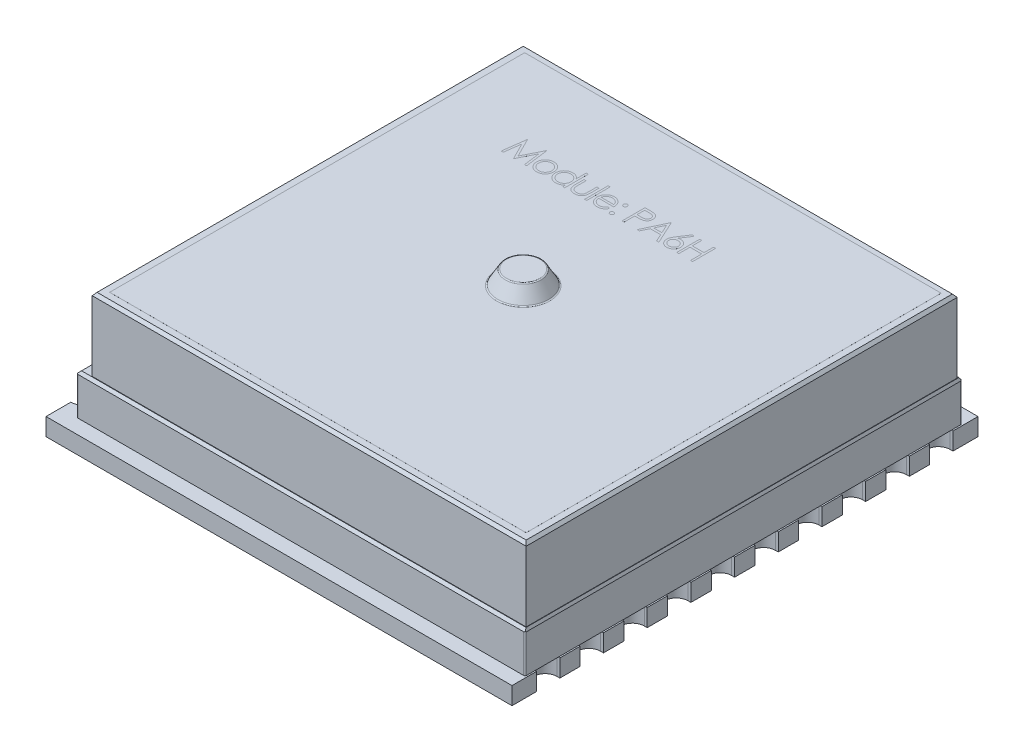
from build123d import *
from OCP.BRepFilletAPI import BRepFilletAPI_MakeChamfer

# Parameters (mm, degrees)
ESBO_O1_W                = 16
ESBO_O1_H                = 16
BASEINICIO_DEPTH         = 0.6
ESBO_O2_W                = 15.4
ESBO_O2_H                = 15
BASEMEIO_DEPTH           = 1.4
ESBO_O5_W                = 14.9
ESBO_O5_H                = 14.8
BASEFIM_DEPTH            = 2.5
ESBO_O9_R                = 0.6
CHAPEU_DEPTH             = 0.5
INCLINA_OCHAPEU_ANGLE    = 30
ESBO_O10_W               = 1
ESBO_O10_H               = 1
PADS_DEPTH               = 0.0001
ESBO_O11_W               = 0.4
ESBO_O11_H               = 0.6001
CORTE_REVOLU_O1_ANGLE    = 180
ESBO_O11_8_W             = 0.4
ESBO_O11_8_H             = 0.6001
CORTE_REVOLU_O2_ANGLE    = 180
ESBO_O11_9_W             = 0.4
ESBO_O11_9_H             = 0.6001
CORTE_REVOLU_O3_ANGLE    = 180
ESBO_O11_11_W            = 0.4
ESBO_O11_11_H            = 0.6001
CORTE_REVOLU_O4_ANGLE    = 180
ESBO_O11_12_W            = 0.4
ESBO_O11_12_H            = 0.6001
CORTE_REVOLU_O5_ANGLE    = 180
ESBO_O11_15_W            = 0.4
ESBO_O11_15_H            = 0.6001
ESBO_O11_16_W            = 0.4
ESBO_O11_16_H            = 0.6001
ESBO_O11_17_W            = 0.4
ESBO_O11_17_H            = 0.6001
ESBO_O11_19_W            = 0.4
ESBO_O11_19_H            = 0.6001
ESBO_O11_20_W            = 0.4
ESBO_O11_20_H            = 0.6001
ESBO_O15_W               = 0.8
ESBO_O15_H               = 0.6001
CORTE_EXTRUS_O3_DEPTH    = 0.5
FILETE5_R                = 0.4
FILETE6_R                = 0.4
FILETE7_R                = 0.4
FILETE8_R                = 0.4
FILETE9_R                = 0.4
FILETE10_R               = 0.4
FILETE11_R               = 0.4
FILETE12_R               = 0.4
FILETE13_R               = 0.4
FILETE14_R               = 0.4
CHANFRO2_SIZE            = 0.1
CHANFRO3_SIZE            = 0.1
CHANFRO3_SIZE2           = 0.070020754
CHANFRO4_SIZE            = 0.1
CHANFRO4_SIZE2           = 0.036397023
CHANFRO5_SIZE            = 0.1
CHANFRO5_SIZE2           = 0.083909963
ESBO_O16_W               = 14.299969375
ESBO_O16_H               = 14.24827011
RESSALTO_EXTRUS_O7_DEPTH = 0.001
FILETE15_R               = 0.05
ESBO_O17_W               = 0.07053833
ESBO_O17_H               = 0.806152344
RESSALTO_EXTRUS_O8_DEPTH = 0.0001
FILETE19_R               = 0.05
FILETE20_R               = 0.05


with BuildPart() as part:
    # Esboço1 → BaseInicio (new body)
    with BuildSketch(Plane(origin=(0, 0, 0), x_dir=(1, 0, 0), z_dir=(0, 1, 0))):
        with Locations((8, -8)):
            Rectangle(ESBO_O1_W, ESBO_O1_H)
    extrude(amount=BASEINICIO_DEPTH)

    # Esboço2 → BaseMeio (add)
    with BuildSketch(Plane(origin=(0, 0.6, 0), x_dir=(1, 0, 0), z_dir=(0, 1, 0))):
        with Locations((8.25, -8)):
            Rectangle(ESBO_O2_W, ESBO_O2_H)
    extrude(amount=BASEMEIO_DEPTH)

    # Esboço5 → BaseFim (add)
    with BuildSketch(Plane(origin=(0, 2, 0), x_dir=(1, 0, 0), z_dir=(0, 1, 0))):
        with Locations((8.45, -8.014489778)):
            Rectangle(ESBO_O5_W, ESBO_O5_H)
    extrude(amount=BASEFIM_DEPTH)

    # Esboço9 → Chapeu (add)
    with BuildSketch(Plane(origin=(0, 4.5, 0), x_dir=(1, 0, 0), z_dir=(0, 1, 0))):
        with Locations(Location((8.2, -7.814489778, 0), (0, 0, 270))):
            Circle(ESBO_O9_R)
    extrude(amount=CHAPEU_DEPTH)

    # InclinaçãoChapeu
    inclina_ochapeu_faces = [part.faces().sort_by_distance(p)[0] for p in [
        (8.2, 4.75, 7.214489778),
    ]]
    draft(inclina_ochapeu_faces, Plane(origin=(8.2, 5, 7.814489778), x_dir=(0, 0, 1), z_dir=(0, 1, 0)), INCLINA_OCHAPEU_ANGLE)

    # Esboço10 → Pads (add)
    with BuildSketch(Plane.XZ):
        with Locations((0.5, 1.25)):
            Rectangle(ESBO_O10_W, ESBO_O10_H)
        with Locations((0.5, 2.75)):
            Rectangle(ESBO_O10_W, ESBO_O10_H)
        with Locations((0.5, 4.25)):
            Rectangle(ESBO_O10_W, ESBO_O10_H)
        with Locations((0.5, 5.75)):
            Rectangle(ESBO_O10_W, ESBO_O10_H)
        with Locations((0.5, 7.25)):
            Rectangle(ESBO_O10_W, ESBO_O10_H)
        with Locations((0.5, 8.75)):
            Rectangle(ESBO_O10_W, ESBO_O10_H)
        with Locations((0.5, 10.25)):
            Rectangle(ESBO_O10_W, ESBO_O10_H)
        with Locations((0.5, 11.75)):
            Rectangle(ESBO_O10_W, ESBO_O10_H)
        with Locations((0.5, 13.25)):
            Rectangle(ESBO_O10_W, ESBO_O10_H)
        with Locations((0.5, 14.75)):
            Rectangle(ESBO_O10_W, ESBO_O10_H)
        with Locations((15.5, 1.258060648)):
            Rectangle(ESBO_O10_W, ESBO_O10_H)
        with Locations((15.5, 2.758060648)):
            Rectangle(ESBO_O10_W, ESBO_O10_H)
        with Locations((15.5, 4.258060648)):
            Rectangle(ESBO_O10_W, ESBO_O10_H)
        with Locations((15.5, 5.758060648)):
            Rectangle(ESBO_O10_W, ESBO_O10_H)
        with Locations((15.5, 7.258060648)):
            Rectangle(ESBO_O10_W, ESBO_O10_H)
        with Locations((15.5, 8.758060648)):
            Rectangle(ESBO_O10_W, ESBO_O10_H)
        with Locations((15.5, 10.258060648)):
            Rectangle(ESBO_O10_W, ESBO_O10_H)
        with Locations((15.5, 11.758060648)):
            Rectangle(ESBO_O10_W, ESBO_O10_H)
        with Locations((15.5, 13.258060648)):
            Rectangle(ESBO_O10_W, ESBO_O10_H)
        with Locations((15.5, 14.758060648)):
            Rectangle(ESBO_O10_W, ESBO_O10_H)
    extrude(amount=PADS_DEPTH)

    # Esboço11 → Corte-Revolução1 (revolve, cut)
    with BuildSketch(Plane.ZY):
        with Locations((1.05, 0.29995)):
            Rectangle(ESBO_O11_W, ESBO_O11_H)
        with Locations((2.55, 0.29995)):
            Rectangle(ESBO_O11_W, ESBO_O11_H)
        with Locations((4.04999995, 0.29995)):
            Rectangle(ESBO_O11_W, ESBO_O11_H)
        with Locations((5.55, 0.29995)):
            Rectangle(ESBO_O11_W, ESBO_O11_H)
        with Locations((7.04999995, 0.29995)):
            Rectangle(ESBO_O11_W, ESBO_O11_H)
        with Locations((8.54999995, 0.29995)):
            Rectangle(ESBO_O11_W, ESBO_O11_H)
        with Locations((10.04999995, 0.29995)):
            Rectangle(ESBO_O11_W, ESBO_O11_H)
        with Locations((11.54999995, 0.29995)):
            Rectangle(ESBO_O11_W, ESBO_O11_H)
        with Locations((13.04999995, 0.29995)):
            Rectangle(ESBO_O11_W, ESBO_O11_H)
        with Locations((14.54999995, 0.29995)):
            Rectangle(ESBO_O11_W, ESBO_O11_H)
    revolve(axis=Axis((0, 0.6, 1.25), (0, -1, 0)), revolution_arc=CORTE_REVOLU_O1_ANGLE, mode=Mode.SUBTRACT)

    # Esboço11<8> → Corte-Revolução2 (revolve, cut)
    with BuildSketch(Plane.ZY):
        with Locations((2.55, 0.29995)):
            Rectangle(ESBO_O11_8_W, ESBO_O11_8_H)
    revolve(axis=Axis((0, 0.6, 2.75), (0, -1, 0)), revolution_arc=CORTE_REVOLU_O2_ANGLE, mode=Mode.SUBTRACT)

    # Esboço11<9> → Corte-Revolução3 (revolve, cut)
    with BuildSketch(Plane.ZY):
        with Locations((4.04999995, 0.29995)):
            Rectangle(ESBO_O11_9_W, ESBO_O11_9_H)
    revolve(axis=Axis((0, 0.6, 4.24999995), (0, -1, 0)), revolution_arc=CORTE_REVOLU_O3_ANGLE, mode=Mode.SUBTRACT)

    # Esboço11<11> → Corte-Revolução4 (revolve, cut)
    with BuildSketch(Plane.ZY):
        with Locations((5.55, 0.29995)):
            Rectangle(ESBO_O11_11_W, ESBO_O11_11_H)
    revolve(axis=Axis((0, 0.6, 5.75), (0, -1, 0)), revolution_arc=CORTE_REVOLU_O4_ANGLE, mode=Mode.SUBTRACT)

    # Esboço11<12> → Corte-Revolução5 (revolve, cut)
    with BuildSketch(Plane.ZY):
        with Locations((7.04999995, 0.29995)):
            Rectangle(ESBO_O11_12_W, ESBO_O11_12_H)
    revolve(axis=Axis((0, 0.6, 7.24999995), (0, -1, 0)), revolution_arc=CORTE_REVOLU_O5_ANGLE, mode=Mode.SUBTRACT)

    # Esboço11<15> → Corte-Revolução8 (revolve, cut)
    with BuildSketch(Plane.ZY):
        with Locations((8.54999995, 0.29995)):
            Rectangle(ESBO_O11_15_W, ESBO_O11_15_H)
    revolve(axis=Axis((0, 0.6, 8.74999995), (0, -1, 0)), mode=Mode.SUBTRACT)

    # Esboço11<16> → Corte-Revolução9 (revolve, cut)
    with BuildSketch(Plane.ZY):
        with Locations((10.04999995, 0.29995)):
            Rectangle(ESBO_O11_16_W, ESBO_O11_16_H)
    revolve(axis=Axis((0, 0.6, 10.24999995), (0, -1, 0)), mode=Mode.SUBTRACT)

    # Esboço11<17> → Corte-Revolução10 (revolve, cut)
    with BuildSketch(Plane.ZY):
        with Locations((11.54999995, 0.29995)):
            Rectangle(ESBO_O11_17_W, ESBO_O11_17_H)
    revolve(axis=Axis((0, 0.6, 11.74999995), (0, -1, 0)), mode=Mode.SUBTRACT)

    # Esboço11<19> → Corte-Revolução11 (revolve, cut)
    with BuildSketch(Plane.ZY):
        with Locations((13.04999995, 0.29995)):
            Rectangle(ESBO_O11_19_W, ESBO_O11_19_H)
    revolve(axis=Axis((0, 0.6, 13.24999995), (0, -1, 0)), mode=Mode.SUBTRACT)

    # Esboço11<20> → Corte-Revolução12 (revolve, cut)
    with BuildSketch(Plane.ZY):
        with Locations((14.54999995, 0.29995)):
            Rectangle(ESBO_O11_20_W, ESBO_O11_20_H)
    revolve(axis=Axis((0, 0.6, 14.74999995), (0, -1, 0)), mode=Mode.SUBTRACT)

    # Esboço15 → Corte-extrusão3 (cut)
    with BuildSketch(Plane(origin=(16, 0, 0), x_dir=(0, 0, -1), z_dir=(1, 0, 0))):
        with Locations((-13.258060648, 0.29995)):
            Rectangle(ESBO_O15_W, ESBO_O15_H)
        with Locations((-14.758060648, 0.29995)):
            Rectangle(ESBO_O15_W, ESBO_O15_H)
        with Locations((-11.758060648, 0.29995)):
            Rectangle(ESBO_O15_W, ESBO_O15_H)
        with Locations((-10.258060648, 0.29995)):
            Rectangle(ESBO_O15_W, ESBO_O15_H)
        with Locations((-8.758060648, 0.29995)):
            Rectangle(ESBO_O15_W, ESBO_O15_H)
        with Locations((-7.258060648, 0.29995)):
            Rectangle(ESBO_O15_W, ESBO_O15_H)
        with Locations((-5.758060648, 0.29995)):
            Rectangle(ESBO_O15_W, ESBO_O15_H)
        with Locations((-4.258060648, 0.29995)):
            Rectangle(ESBO_O15_W, ESBO_O15_H)
        with Locations((-2.758060648, 0.29995)):
            Rectangle(ESBO_O15_W, ESBO_O15_H)
        with Locations((-1.258060648, 0.29995)):
            Rectangle(ESBO_O15_W, ESBO_O15_H)
    extrude(amount=-CORTE_EXTRUS_O3_DEPTH, mode=Mode.SUBTRACT)

    # Filete5
    filete5_edges = [part.edges().sort_by_distance(p)[0] for p in [
        (15.5, 0.29995, 15.158060648),
        (15.5, 0.29995, 14.358060648),
    ]]
    fillet(filete5_edges, radius=FILETE5_R - 0.0001)  # a hair under: the kernel refuses the full size

    # Filete6
    filete6_edges = [part.edges().sort_by_distance(p)[0] for p in [
        (15.5, 0.29995, 13.658060648),
        (15.5, 0.29995, 12.858060648),
    ]]
    fillet(filete6_edges, radius=FILETE6_R - 0.0001)  # a hair under: the kernel refuses the full size

    # Filete7
    filete7_edges = [part.edges().sort_by_distance(p)[0] for p in [
        (15.5, 0.29995, 12.158060648),
        (15.5, 0.29995, 11.358060648),
    ]]
    fillet(filete7_edges, radius=FILETE7_R - 0.0001)  # a hair under: the kernel refuses the full size

    # Filete8
    filete8_edges = [part.edges().sort_by_distance(p)[0] for p in [
        (15.5, 0.29995, 10.658060648),
        (15.5, 0.29995, 9.858060648),
    ]]
    fillet(filete8_edges, radius=FILETE8_R - 0.0001)  # a hair under: the kernel refuses the full size

    # Filete9
    filete9_edges = [part.edges().sort_by_distance(p)[0] for p in [
        (15.5, 0.29995, 9.158060648),
        (15.5, 0.29995, 8.358060648),
    ]]
    fillet(filete9_edges, radius=FILETE9_R - 0.0001)  # a hair under: the kernel refuses the full size

    # Filete10
    filete10_edges = [part.edges().sort_by_distance(p)[0] for p in [
        (15.5, 0.29995, 7.658060648),
        (15.5, 0.29995, 6.858060648),
    ]]
    fillet(filete10_edges, radius=FILETE10_R - 0.0001)  # a hair under: the kernel refuses the full size

    # Filete11
    filete11_edges = [part.edges().sort_by_distance(p)[0] for p in [
        (15.5, 0.29995, 6.158060648),
        (15.5, 0.29995, 5.358060648),
    ]]
    fillet(filete11_edges, radius=FILETE11_R - 0.0001)  # a hair under: the kernel refuses the full size

    # Filete12
    filete12_edges = [part.edges().sort_by_distance(p)[0] for p in [
        (15.5, 0.29995, 4.658060648),
        (15.5, 0.29995, 3.858060648),
    ]]
    fillet(filete12_edges, radius=FILETE12_R - 0.0001)  # a hair under: the kernel refuses the full size

    # Filete13
    filete13_edges = [part.edges().sort_by_distance(p)[0] for p in [
        (15.5, 0.29995, 3.158060648),
        (15.5, 0.29995, 2.358060648),
    ]]
    fillet(filete13_edges, radius=FILETE13_R - 0.0001)  # a hair under: the kernel refuses the full size

    # Filete14
    filete14_edges = [part.edges().sort_by_distance(p)[0] for p in [
        (15.5, 0.29995, 1.658060648),
        (15.5, 0.29995, 0.858060648),
    ]]
    fillet(filete14_edges, radius=FILETE14_R - 0.0001)  # a hair under: the kernel refuses the full size

    # Chanfro2
    chanfro2_edges = [part.edges().sort_by_distance(p)[0] for p in [
        (0.55, 2, 8),
    ]]
    chamfer(chanfro2_edges, length=CHANFRO2_SIZE)

    # Chanfro3: one chamfer whose edges measure the first distance from different faces: ONE call of the kernel's chamfer builder (chamfer() names one face for all edges)
    chanfro3_edges_1 = [part.edges().sort_by_distance(p)[0] for p in [
        (8.3, 2, 15.5),
    ]]
    chanfro3_side_1 = [part.faces().sort_by_distance(p)[0] for p in [
        (8.251778396, 1.299845357, 15.5),
    ]]
    chanfro3_edges_2 = [part.edges().sort_by_distance(p)[0] for p in [
        (8.3, 2, 0.5),
    ]]
    chanfro3_side_2 = [part.faces().sort_by_distance(p)[0] for p in [
        (8.251778396, 1.299845357, 0.5),
    ]]
    chanfro3 = BRepFilletAPI_MakeChamfer(part.part.solid().wrapped)
    for e in chanfro3_edges_1:
        chanfro3.Add(CHANFRO3_SIZE, CHANFRO3_SIZE2, e.wrapped, chanfro3_side_1[0].wrapped)  # the first distance lies on this face
    for e in chanfro3_edges_2:
        chanfro3.Add(CHANFRO3_SIZE, CHANFRO3_SIZE2, e.wrapped, chanfro3_side_2[0].wrapped)  # the first distance lies on this face
    add(Compound.cast(chanfro3.Shape()), mode=Mode.REPLACE)

    # Chanfro4
    chanfro4_edges = [part.edges().sort_by_distance(p)[0] for p in [
        (15.95, 2, 8),
    ]]
    chanfro4_side = [part.faces().sort_by_distance(p)[0] for p in [
        (15.95, 1.299777638, 8),
    ]]
    chamfer(chanfro4_edges, length=CHANFRO4_SIZE, length2=CHANFRO4_SIZE2, reference=chanfro4_side[0])

    # Chanfro5: one chamfer whose edges measure the first distance from different faces: ONE call of the kernel's chamfer builder (chamfer() names one face for all edges)
    chanfro5_edges_1 = [part.edges().sort_by_distance(p)[0] for p in [
        (15.9, 4.5, 8.014489778),
    ]]
    chanfro5_side_1 = [part.faces().sort_by_distance(p)[0] for p in [
        (15.9, 3.25, 8.014489778),
    ]]
    chanfro5_edges_2 = [part.edges().sort_by_distance(p)[0] for p in [
        (8.45, 4.5, 0.614489778),
    ]]
    chanfro5_side_2 = [part.faces().sort_by_distance(p)[0] for p in [
        (8.45, 3.25, 0.614489778),
    ]]
    chanfro5_edges_3 = [part.edges().sort_by_distance(p)[0] for p in [
        (1, 4.5, 8.014489778),
    ]]
    chanfro5_side_3 = [part.faces().sort_by_distance(p)[0] for p in [
        (1, 3.25, 8.014489778),
    ]]
    chanfro5_edges_4 = [part.edges().sort_by_distance(p)[0] for p in [
        (8.45, 4.5, 15.414489778),
    ]]
    chanfro5_side_4 = [part.faces().sort_by_distance(p)[0] for p in [
        (8.45, 3.25, 15.414489778),
    ]]
    chanfro5 = BRepFilletAPI_MakeChamfer(part.part.solid().wrapped)
    for e in chanfro5_edges_1:
        chanfro5.Add(CHANFRO5_SIZE, CHANFRO5_SIZE2, e.wrapped, chanfro5_side_1[0].wrapped)  # the first distance lies on this face
    for e in chanfro5_edges_2:
        chanfro5.Add(CHANFRO5_SIZE, CHANFRO5_SIZE2, e.wrapped, chanfro5_side_2[0].wrapped)  # the first distance lies on this face
    for e in chanfro5_edges_3:
        chanfro5.Add(CHANFRO5_SIZE, CHANFRO5_SIZE2, e.wrapped, chanfro5_side_3[0].wrapped)  # the first distance lies on this face
    for e in chanfro5_edges_4:
        chanfro5.Add(CHANFRO5_SIZE, CHANFRO5_SIZE2, e.wrapped, chanfro5_side_4[0].wrapped)  # the first distance lies on this face
    add(Compound.cast(chanfro5.Shape()), mode=Mode.REPLACE)

    # Esboço16 → Ressalto-extrusão7 (add)
    with BuildSketch(Plane(origin=(0, 4.5, 0), x_dir=(1, 0, 0), z_dir=(0, 1, 0))):
        with Locations((8.449984688, -7.990354723)):
            Rectangle(ESBO_O16_W, ESBO_O16_H)
    extrude(amount=RESSALTO_EXTRUS_O7_DEPTH)

    # Filete15
    filete15_edges = [part.edges().sort_by_distance(p)[0] for p in [
        (8.2, 5, 7.214489778),
    ]]
    fillet(filete15_edges, radius=FILETE15_R)

    # Esboço17 → Ressalto-extrusão8 (add)
    # profile 1 of 12: a face of its own
    with BuildSketch(Plane(origin=(0, 4.501, 0), x_dir=(1, 0, 0), z_dir=(0, 1, 0))):
        Polygon((3.821372899, -4.194593639), (3.925133523, -3.408595104), (3.935210427, -3.408595104), (4.259718236, -4.053516979), (4.583438787, -3.408595104), (4.593673143, -3.408595104), (4.698063573, -4.194593639), (4.62721034, -4.194593639), (4.551948461, -3.629027385), (4.268220624, -4.194593639), (4.25231801, -4.194593639), (3.967488012, -3.627767772), (3.892383584, -4.194593639), align=None)
    # profile 2 of 12: a face of its own
    with BuildSketch(Plane(origin=(0, 4.501, 0), x_dir=(1, 0, 0), z_dir=(0, 1, 0))):
        with BuildLine():
            add(Edge.make_bspline(
                [(5.050062436, -3.61013319), (5.060839885, -3.610362677), (5.081971828, -3.610812645), (5.112919484, -3.615621825), (5.142460708, -3.622975934), (5.17070864, -3.633142614), (5.197301507, -3.646770021), (5.222626659, -3.663031049), (5.246614663, -3.682295333), (5.260992379, -3.697197431), (5.268290395, -3.704761619)],
                knots=[0, 0, 0, 0, 1.054011418, 2.066658804, 3.057071809, 4.030435133, 4.997543892, 5.974964718, 6.972108034, 8, 8, 8, 8], degree=3))
            add(Edge.make_bspline(
                [(5.268290395, -3.704761619), (5.274574331, -3.711995946), (5.287020591, -3.726324597), (5.302979891, -3.749557728), (5.316728478, -3.773618289), (5.327746597, -3.798825784), (5.336434132, -3.824960162), (5.342602131, -3.852111249), (5.346270933, -3.880219083), (5.346765656, -3.899308481), (5.34701621, -3.908976383)],
                knots=[0, 0, 0, 0, 1.025258237, 2.030674902, 3.01204498, 3.988269485, 4.97094183, 5.956517959, 6.965070386, 8, 8, 8, 8], degree=3))
            add(Edge.make_bspline(
                [(5.34701621, -3.908976383), (5.34679583, -3.91870032), (5.346360349, -3.937915275), (5.342240904, -3.966215571), (5.33583365, -3.993656986), (5.326664003, -4.020124632), (5.314905889, -4.045699413), (5.300557893, -4.070269626), (5.283519327, -4.093883747), (5.264205323, -4.116341261), (5.242859427, -4.137039121), (5.219702529, -4.155078521), (5.195189698, -4.170533841), (5.168994982, -4.182983252), (5.141357592, -4.192799184), (5.112217916, -4.199693518), (5.081621223, -4.203861934), (5.060730006, -4.204397215), (5.050062436, -4.204670543)],
                knots=[0, 0, 0, 0, 0.998656419, 1.973391657, 2.932242238, 3.890759089, 4.846373663, 5.82037756, 6.809684879, 7.83454468, 8.860553229, 9.859544525, 10.845671541, 11.83227036, 12.833544569, 13.85385346, 14.904124723, 16, 16, 16, 16], degree=3))
            add(Edge.make_bspline(
                [(5.050062436, -4.204670543), (5.039342602, -4.204396298), (5.018347265, -4.203859175), (4.987642573, -4.199709713), (4.958450673, -4.192802361), (4.930777103, -4.182950994), (4.904469766, -4.170533443), (4.879814901, -4.155125246), (4.856639192, -4.137033771), (4.835288781, -4.11634271), (4.815975987, -4.093883373), (4.798937109, -4.070269723), (4.784589194, -4.045699388), (4.772831059, -4.020124638), (4.763661418, -3.993656984), (4.757254161, -3.966215571), (4.753134717, -3.937915275), (4.752699236, -3.91870032), (4.752478856, -3.908976383)],
                knots=[0, 0, 0, 0, 1.099876186, 2.154163076, 3.173186993, 4.173200201, 5.163417411, 6.152872554, 7.150605724, 8.17532212, 9.198891216, 10.186952605, 11.159729845, 12.11414092, 13.071450619, 14.029093627, 15.002601286, 16, 16, 16, 16], degree=3))
            add(Edge.make_bspline(
                [(4.752478856, -3.908976383), (4.752731119, -3.899361028), (4.753230556, -3.880324277), (4.75689567, -3.852269281), (4.763039608, -3.825164147), (4.771737557, -3.799130645), (4.782857234, -3.774033614), (4.796412629, -3.749913603), (4.812534724, -3.726785528), (4.824931482, -3.712475397), (4.831204671, -3.705233974)],
                knots=[0, 0, 0, 0, 1.031353054, 2.041901799, 3.029428768, 4.008703097, 4.981709435, 5.96992636, 6.972712378, 8, 8, 8, 8], degree=3))
            add(Edge.make_bspline(
                [(4.831204671, -3.705233974), (4.838491684, -3.697604187), (4.852822877, -3.68259887), (4.876930289, -3.663390745), (4.90219314, -3.646791337), (4.929079888, -3.633434703), (4.957304614, -3.62291613), (4.986997223, -3.61560286), (5.018049895, -3.610829972), (5.039285245, -3.610367765), (5.050062436, -3.61013319)],
                knots=[0, 0, 0, 0, 1.027980169, 2.021703884, 2.998553061, 3.971491411, 4.943284454, 5.930300938, 6.949603206, 8, 8, 8, 8], degree=3))
        make_face()
        with BuildLine():
            add(Edge.make_bspline(
                [(5.049747533, -3.68067152), (5.042126129, -3.680888139), (5.027080067, -3.681315786), (5.004932968, -3.684568451), (4.983612161, -3.689721795), (4.963077199, -3.697043721), (4.943397329, -3.706497913), (4.924553709, -3.718110112), (4.906490915, -3.731726516), (4.889562289, -3.747325818), (4.874025947, -3.764366041), (4.860444347, -3.782522238), (4.848895759, -3.801499914), (4.839275101, -3.821318802), (4.832109672, -3.842179745), (4.826905683, -3.863846498), (4.823656086, -3.886363204), (4.82323246, -3.901670193), (4.823017186, -3.909448738)],
                knots=[0, 0, 0, 0, 1.021534396, 2.016698045, 2.994645724, 3.958388632, 4.93408049, 5.916473867, 6.921342795, 7.962252576, 8.998418191, 10.008913653, 10.997312074, 11.973003931, 12.956656626, 13.948281152, 14.957379055, 16, 16, 16, 16], degree=3))
            add(Edge.make_bspline(
                [(4.823017186, -3.909448738), (4.823378032, -3.919498745), (4.824094244, -3.939446132), (4.829918546, -3.968822518), (4.839661847, -3.997024561), (4.852818852, -4.023886934), (4.86930376, -4.048740719), (4.888726248, -4.070899474), (4.910877865, -4.090029738), (4.935494554, -4.105902607), (4.962073502, -4.11851446), (4.990202441, -4.127452156), (5.019540553, -4.133262188), (5.039590417, -4.133839667), (5.049747533, -4.134132213)],
                knots=[0, 0, 0, 0, 1.016792936, 2.018143844, 3.017858371, 4.030088057, 5.03801393, 6.028138512, 7.003788237, 7.991172063, 8.984598303, 9.972568034, 10.972917682, 12, 12, 12, 12], degree=3))
            add(Edge.make_bspline(
                [(5.049747533, -4.134132213), (5.059904064, -4.133837962), (5.079952775, -4.133257119), (5.109250124, -4.127481417), (5.137302181, -4.118475298), (5.163853523, -4.105916791), (5.188459006, -4.089969461), (5.210769939, -4.071007499), (5.230026591, -4.04868203), (5.246495192, -4.023854014), (5.259867665, -3.997066206), (5.26956536, -3.968817313), (5.275403664, -3.939447458), (5.276117986, -3.91949919), (5.27647788, -3.909448738)],
                knots=[0, 0, 0, 0, 1.02726834, 2.027799167, 3.010890988, 4.004497153, 4.992059811, 5.971914811, 6.958719428, 7.966827853, 8.981595046, 9.981490638, 10.983022906, 12, 12, 12, 12], degree=3))
            add(Edge.make_bspline(
                [(5.27647788, -3.909448738), (5.27626268, -3.901670146), (5.2758392, -3.886363066), (5.272588543, -3.863847026), (5.26738848, -3.84217781), (5.260208581, -3.821325942), (5.250629726, -3.8014486), (5.238858434, -3.782577959), (5.225332292, -3.764303146), (5.209608476, -3.747380902), (5.192697521, -3.731720435), (5.174627406, -3.718104832), (5.155811729, -3.706548947), (5.136189032, -3.696962855), (5.115651437, -3.689788409), (5.094360504, -3.684538695), (5.072307898, -3.681329531), (5.057315752, -3.68089226), (5.049747533, -3.68067152)],
                knots=[0, 0, 0, 0, 1.042956736, 2.052379634, 3.044323526, 4.02829302, 5.004299113, 5.996692471, 7.007513377, 8.048758398, 9.090003419, 10.095195979, 11.07790575, 12.047570684, 13.018257071, 13.989683339, 14.985167495, 16, 16, 16, 16], degree=3))
        make_face(mode=Mode.SUBTRACT)
    # profile 3 of 12: a face of its own
    with BuildSketch(Plane(origin=(0, 4.501, 0), x_dir=(1, 0, 0), z_dir=(0, 1, 0))):
        with BuildLine():
            Line((6.006045751, -3.388441295), (6.006045751, -4.194593639))
            Line((6.006045751, -4.194593639), (5.935507421, -4.194593639))
            Line((5.935507421, -4.194593639), (5.935507421, -4.09524166))
            add(Edge.make_bspline(
                [(5.935507421, -4.09524166), (5.927553387, -4.104233393), (5.912030991, -4.121780871), (5.886106262, -4.144705567), (5.858625917, -4.163654492), (5.829723331, -4.178958988), (5.799424605, -4.190455239), (5.767796903, -4.198626516), (5.734827322, -4.203880093), (5.71231355, -4.204404696), (5.700904493, -4.204670543)],
                knots=[0, 0, 0, 0, 1.074387032, 2.096679803, 3.090159297, 4.057316773, 5.018401886, 5.985159533, 6.978961417, 8, 8, 8, 8], degree=3))
            add(Edge.make_bspline(
                [(5.700904493, -4.204670543), (5.69076108, -4.204395135), (5.67075782, -4.203852019), (5.641332488, -4.19963855), (5.613015824, -4.192872086), (5.585781071, -4.183462361), (5.55980446, -4.170980519), (5.534863582, -4.156037284), (5.511087645, -4.138242091), (5.488839049, -4.117898646), (5.468350987, -4.095801984), (5.450371546, -4.072234257), (5.435380739, -4.047297374), (5.422845167, -4.021307063), (5.413189435, -3.994063249), (5.406458225, -3.965660144), (5.402249664, -3.93613133), (5.401706773, -3.916023349), (5.401431493, -3.90582735)],
                knots=[0, 0, 0, 0, 1.033919861, 2.038935746, 3.024066025, 3.998881131, 4.97069526, 5.957263378, 6.95902576, 7.993208707, 9.027059324, 10.027763471, 11.009749337, 11.988697705, 12.965288445, 13.950418724, 14.960734635, 16, 16, 16, 16], degree=3))
            add(Edge.make_bspline(
                [(5.401431493, -3.90582735), (5.401712874, -3.895842091), (5.402269149, -3.876101773), (5.406413207, -3.847069525), (5.413381872, -3.819106334), (5.423161456, -3.792302225), (5.435701941, -3.766624764), (5.45095662, -3.742055792), (5.468926595, -3.718527622), (5.489643812, -3.696593496), (5.512086264, -3.676332562), (5.536094866, -3.658724163), (5.56107239, -3.643516922), (5.587406263, -3.631467907), (5.614706711, -3.62171948), (5.643216774, -3.614974946), (5.672817833, -3.611000641), (5.692914804, -3.610425118), (5.703108815, -3.61013319)],
                knots=[0, 0, 0, 0, 1.020392517, 2.01726096, 2.990465484, 3.961182959, 4.928053699, 5.906110375, 6.912531644, 7.948652711, 8.985773172, 9.998621852, 10.987621588, 11.969261332, 12.953316658, 13.946091881, 14.958173133, 16, 16, 16, 16], degree=3))
            add(Edge.make_bspline(
                [(5.703108815, -3.61013319), (5.714835197, -3.610485114), (5.73785278, -3.611175902), (5.771515642, -3.616948807), (5.803357029, -3.626641938), (5.833560255, -3.639912127), (5.861945258, -3.657159349), (5.888720105, -3.677988635), (5.913419171, -3.702989485), (5.928032416, -3.721766221), (5.935507421, -3.731370944)],
                knots=[0, 0, 0, 0, 1.031072012, 2.023879775, 2.993683497, 3.952812103, 4.918022106, 5.908088563, 6.929940113, 8, 8, 8, 8], degree=3))
            Line((5.935507421, -3.731370944), (5.935507421, -3.388441295))
            Line((5.935507421, -3.388441295), (6.006045751, -3.388441295))
        make_face()
        with BuildLine():
            add(Edge.make_bspline(
                [(5.704053525, -3.68067152), (5.693742496, -3.681038387), (5.673390164, -3.681762526), (5.643512338, -3.687415763), (5.614921436, -3.696821829), (5.587760454, -3.709685683), (5.562458439, -3.725861249), (5.53984556, -3.745426186), (5.519736865, -3.767846685), (5.502824812, -3.79302157), (5.489038286, -3.820010085), (5.479344222, -3.848221692), (5.472950854, -3.877147556), (5.472297685, -3.896766682), (5.471969823, -3.906614608)],
                knots=[0, 0, 0, 0, 1.031046209, 2.035121221, 3.029706178, 4.034933723, 5.034054252, 6.02443088, 7.017295772, 8.038157696, 9.050218397, 10.03989886, 11.016116709, 12, 12, 12, 12], degree=3))
            add(Edge.make_bspline(
                [(5.471969823, -3.906614608), (5.472388624, -3.916403683), (5.473224584, -3.935943462), (5.479232015, -3.96490876), (5.489310733, -3.993127015), (5.503063925, -4.020358719), (5.520285518, -4.045641844), (5.540247333, -4.068489726), (5.56314241, -4.088137351), (5.588502655, -4.104584387), (5.615587708, -4.117870574), (5.644070932, -4.127115183), (5.673416892, -4.133083782), (5.693370551, -4.133780958), (5.703423719, -4.134132213)],
                knots=[0, 0, 0, 0, 0.979072187, 1.954306742, 2.945804271, 3.96968567, 4.997920485, 5.998718438, 6.996577872, 8.005894225, 9.015743152, 10.005417472, 10.995077863, 12, 12, 12, 12], degree=3))
            add(Edge.make_bspline(
                [(5.703423719, -4.134132213), (5.713629686, -4.133759433), (5.733928342, -4.133018011), (5.763894807, -4.127340572), (5.792975622, -4.117960511), (5.820774645, -4.104958045), (5.846671305, -4.088843423), (5.869913928, -4.069977866), (5.889567477, -4.048036563), (5.906228986, -4.023922925), (5.919293498, -3.997488223), (5.928809933, -3.969341797), (5.934436314, -3.939482668), (5.935145448, -3.919077264), (5.935507421, -3.908661479)],
                knots=[0, 0, 0, 0, 1.01762866, 2.023962475, 3.030623092, 4.058876274, 5.077231937, 6.066672613, 7.034107872, 8.005628644, 8.981990164, 9.965428785, 10.961468474, 12, 12, 12, 12], degree=3))
            add(Edge.make_bspline(
                [(5.935507421, -3.908661479), (5.93529191, -3.900725627), (5.934867716, -3.885105358), (5.931627028, -3.862170479), (5.926472017, -3.840222317), (5.919208005, -3.819237798), (5.909665695, -3.799332943), (5.898156932, -3.780364831), (5.884479334, -3.762432115), (5.868853077, -3.74578173), (5.851748581, -3.730594788), (5.833649383, -3.717038729), (5.814341049, -3.705902528), (5.79414829, -3.696685848), (5.773036069, -3.68935155), (5.750832594, -3.684458666), (5.72777387, -3.681099011), (5.712043557, -3.680815517), (5.704053525, -3.68067152)],
                knots=[0, 0, 0, 0, 1.050140795, 2.067009409, 3.05949893, 4.030605086, 5.00011959, 5.97591094, 6.962425594, 7.979863591, 8.993523472, 9.986985069, 10.967611495, 11.937549037, 12.921786183, 13.919465291, 14.943216303, 16, 16, 16, 16], degree=3))
        make_face(mode=Mode.SUBTRACT)
    # profile 4 of 12: a face of its own
    with BuildSketch(Plane(origin=(0, 4.501, 0), x_dir=(1, 0, 0), z_dir=(0, 1, 0))):
        with BuildLine():
            Line((6.090691747, -3.620210094), (6.161230077, -3.620210094))
            Line((6.161230077, -3.620210094), (6.161230077, -3.886618251))
            add(Edge.make_bspline(
                [(6.161230077, -3.886618251), (6.161261945, -3.894438431), (6.161322906, -3.909398069), (6.161736328, -3.930924365), (6.162708742, -3.950555625), (6.16392453, -3.968303188), (6.165488024, -3.984164053), (6.167348226, -3.998082819), (6.169427399, -4.010217331), (6.171462622, -4.017525625), (6.172409143, -4.020924491)],
                knots=[0, 0, 0, 0, 1.388932606, 2.656963016, 3.823490214, 4.879454478, 5.816252168, 6.653371382, 7.373723809, 8, 8, 8, 8], degree=3))
            add(Edge.make_bspline(
                [(6.172409143, -4.020924491), (6.173927569, -4.025196477), (6.176932855, -4.033651634), (6.182383976, -4.045865828), (6.18912747, -4.057178656), (6.196506835, -4.06802635), (6.205017943, -4.078087578), (6.214553109, -4.087345348), (6.224793151, -4.09614945), (6.240008965, -4.10656613), (6.26081755, -4.117730751), (6.288137232, -4.127363909), (6.317759098, -4.133120971), (6.338232051, -4.133788902), (6.348754968, -4.134132213)],
                knots=[0, 0, 0, 0, 0.725840625, 1.436591201, 2.137033971, 2.831655856, 3.53531722, 4.242432219, 4.957935707, 5.694543706, 7.190802206, 8.724350549, 10.316345118, 12, 12, 12, 12], degree=3))
            add(Edge.make_bspline(
                [(6.348754968, -4.134132213), (6.359276907, -4.133781602), (6.379634914, -4.133103234), (6.408931318, -4.12753757), (6.435711728, -4.118239052), (6.459707354, -4.105257184), (6.480809358, -4.089370567), (6.498394261, -4.070729195), (6.512903177, -4.049922829), (6.519238195, -4.034399519), (6.522424115, -4.02659275)],
                knots=[0, 0, 0, 0, 1.157059328, 2.238695713, 3.266970494, 4.264342957, 5.228770407, 6.160125903, 7.074715775, 8, 8, 8, 8], degree=3))
            add(Edge.make_bspline(
                [(6.522424115, -4.02659275), (6.523366018, -4.023456324), (6.525448334, -4.016522453), (6.52768559, -4.00475948), (6.529700993, -3.99073174), (6.531421921, -3.974347442), (6.532649238, -3.955649401), (6.53331083, -3.93464346), (6.534058264, -3.911395564), (6.534069609, -3.895121406), (6.534075536, -3.886618251)],
                knots=[0, 0, 0, 0, 0.557542046, 1.232589297, 2.036731608, 2.971723315, 4.038036528, 5.22795436, 6.551621927, 8, 8, 8, 8], degree=3))
            Line((6.534075536, -3.886618251), (6.534075536, -3.620210094))
            Line((6.534075536, -3.620210094), (6.604613866, -3.620210094))
            Line((6.604613866, -3.620210094), (6.604613866, -3.899844188))
            add(Edge.make_bspline(
                [(6.604613866, -3.899844188), (6.604514674, -3.909345152), (6.604322228, -3.927778323), (6.603085439, -3.954566076), (6.60096333, -3.979529894), (6.597742378, -4.00268299), (6.593954837, -4.024007687), (6.589069009, -4.043531317), (6.58323505, -4.061193727), (6.57665388, -4.07730485), (6.568878813, -4.091912497), (6.560608531, -4.105776572), (6.551058701, -4.118553076), (6.541004604, -4.130878013), (6.529820596, -4.142138346), (6.51771625, -4.152592458), (6.504861936, -4.162400155), (6.490972399, -4.171178923), (6.476250407, -4.179087561), (6.460677787, -4.186097787), (6.4440638, -4.191645269), (6.426622799, -4.196431027), (6.408269333, -4.200184612), (6.389021097, -4.202831534), (6.368884575, -4.204454133), (6.355161162, -4.204597195), (6.348125161, -4.204670543)],
                knots=[0, 0, 0, 0, 1.493040784, 2.896703357, 4.213163133, 5.428574705, 6.569057535, 7.615249723, 8.588095153, 9.490268104, 10.346124644, 11.18633936, 12.024365274, 12.850166724, 13.684164916, 14.514361689, 15.362232829, 16.222528818, 17.093394965, 17.986930858, 18.902426812, 19.842810585, 20.827885679, 21.843828298, 22.894529745, 24, 24, 24, 24], degree=3))
            add(Edge.make_bspline(
                [(6.348125161, -4.204670543), (6.341141786, -4.204594255), (6.327418803, -4.204444341), (6.307281241, -4.202840498), (6.287979675, -4.200188725), (6.269582729, -4.196403532), (6.25207194, -4.191678767), (6.235376379, -4.186063698), (6.219691539, -4.179083922), (6.20482898, -4.171228977), (6.190905041, -4.162343763), (6.177855539, -4.152604559), (6.165697971, -4.142025902), (6.154429656, -4.130651974), (6.144208761, -4.11834168), (6.134907919, -4.105194044), (6.126383943, -4.09133934), (6.118669302, -4.076503469), (6.112041817, -4.0602059), (6.106190565, -4.042173499), (6.101404813, -4.022208571), (6.097510197, -4.000328185), (6.094377108, -3.976637057), (6.092201882, -3.95099814), (6.090985643, -3.923473888), (6.090791824, -3.904463977), (6.090691747, -3.894648284)],
                knots=[0, 0, 0, 0, 1.083640291, 2.129454052, 3.13281866, 4.105697902, 5.042300162, 5.946461698, 6.836384745, 7.703652036, 8.553297018, 9.397182691, 10.228592656, 11.052265423, 11.879314572, 12.708807002, 13.549817954, 14.402308542, 15.300838682, 16.27712199, 17.341985831, 18.484375296, 19.725102775, 21.0496083, 22.476576903, 24, 24, 24, 24], degree=3))
            Line((6.090691747, -3.894648284), (6.090691747, -3.620210094))
        make_face()
    # profile 5 of 12: a face of its own
    with BuildSketch(Plane(origin=(0, 4.501, 0), x_dir=(1, 0, 0), z_dir=(0, 1, 0))):
        with Locations((6.724529027, -3.791517467)):
            Rectangle(ESBO_O17_W, ESBO_O17_H)
    # profile 6 of 12: a face of its own
    with BuildSketch(Plane(origin=(0, 4.501, 0), x_dir=(1, 0, 0), z_dir=(0, 1, 0))):
        with BuildLine():
            Line((7.325931272, -4.013209361), (7.38859702, -4.046116752))
            add(Edge.make_bspline(
                [(7.38859702, -4.046116752), (7.383603326, -4.054974581), (7.373887573, -4.072208408), (7.357179322, -4.095885347), (7.339664564, -4.117185394), (7.32055268, -4.135539506), (7.300415469, -4.151540501), (7.279141261, -4.165539769), (7.2566193, -4.177468649), (7.232848521, -4.187518769), (7.207629297, -4.195246144), (7.180900515, -4.200704168), (7.152610969, -4.204077958), (7.13322012, -4.204469866), (7.123291024, -4.204670543)],
                knots=[0, 0, 0, 0, 1.120438281, 2.179929193, 3.190490725, 4.156257408, 5.095198341, 6.022838206, 6.959905092, 7.901321166, 8.864066838, 9.862729781, 10.905609505, 12, 12, 12, 12], degree=3))
            add(Edge.make_bspline(
                [(7.123291024, -4.204670543), (7.112255161, -4.204412921), (7.090727388, -4.203910374), (7.059390806, -4.199577846), (7.029886798, -4.192510067), (7.002217021, -4.182636681), (6.976449237, -4.169740168), (6.952532233, -4.154029297), (6.930340232, -4.135584774), (6.910572547, -4.114246835), (6.892776668, -4.091412015), (6.877073356, -4.067617395), (6.863945511, -4.042922843), (6.853266574, -4.017485567), (6.844641954, -3.991465895), (6.838630929, -3.964627084), (6.835165855, -3.937041773), (6.834634869, -3.91838052), (6.834367284, -3.908976383)],
                knots=[0, 0, 0, 0, 1.145258523, 2.234067595, 3.276747158, 4.290159414, 5.277019952, 6.260822364, 7.254936242, 8.264827045, 9.274100331, 10.257902744, 11.220704747, 12.172965371, 13.118907548, 14.062713208, 15.023725156, 16, 16, 16, 16], degree=3))
            add(Edge.make_bspline(
                [(6.834367284, -3.908976383), (6.834605136, -3.900151903), (6.835076529, -3.882662949), (6.83804778, -3.85677765), (6.843313587, -3.831619307), (6.850539456, -3.807167016), (6.859870662, -3.78346172), (6.871286104, -3.760488989), (6.884803567, -3.738273271), (6.895239983, -3.724259336), (6.900496968, -3.717200298)],
                knots=[0, 0, 0, 0, 1.024358464, 2.0301432, 3.019427413, 4.004406732, 4.986367066, 5.972626655, 6.978780325, 8, 8, 8, 8], degree=3))
            add(Edge.make_bspline(
                [(6.900496968, -3.717200298), (6.907617595, -3.708696047), (6.921633284, -3.69195694), (6.945338181, -3.669962831), (6.971006692, -3.651538177), (6.998317138, -3.636265746), (7.027586931, -3.624661343), (7.058422617, -3.616013656), (7.091175308, -3.611167861), (7.11356621, -3.610483406), (7.125022992, -3.61013319)],
                knots=[0, 0, 0, 0, 1.030682036, 2.02871468, 2.997146059, 3.962720338, 4.930598197, 5.918074684, 6.934738563, 8, 8, 8, 8], degree=3))
            add(Edge.make_bspline(
                [(7.125022992, -3.61013319), (7.136801204, -3.61043727), (7.15990737, -3.611033806), (7.193600235, -3.616564166), (7.225480497, -3.625334238), (7.255535398, -3.63772018), (7.283767985, -3.653700553), (7.309994746, -3.673494655), (7.334664211, -3.696494788), (7.349016225, -3.714182722), (7.356319436, -3.72318346)],
                knots=[0, 0, 0, 0, 1.056321875, 2.072262726, 3.055038591, 4.01806755, 4.982017516, 5.957941055, 6.960871419, 8, 8, 8, 8], degree=3))
            add(Edge.make_bspline(
                [(7.356319436, -3.72318346), (7.361288505, -3.729966308), (7.371193567, -3.743486857), (7.383600464, -3.765533253), (7.394370305, -3.788599075), (7.402978777, -3.813057171), (7.409949349, -3.838617749), (7.414992499, -3.865463539), (7.417950014, -3.893586546), (7.41853136, -3.912748417), (7.418827733, -3.922517223)],
                knots=[0, 0, 0, 0, 0.94817472, 1.890038105, 2.849395472, 3.817997239, 4.812318967, 5.836947057, 6.897266129, 8, 8, 8, 8], degree=3))
            Line((7.418827733, -3.922517223), (6.904905614, -3.922517223))
            add(Edge.make_bspline(
                [(6.904905614, -3.922517223), (6.905251365, -3.93008537), (6.90593127, -3.944967826), (6.909101122, -3.966744653), (6.914097552, -3.987489028), (6.921119677, -4.007045355), (6.929623473, -4.025669057), (6.94004036, -4.043221985), (6.952468019, -4.059624186), (6.966329822, -4.075022378), (6.981759444, -4.088734855), (6.997992053, -4.101008059), (7.015260119, -4.111294668), (7.033427483, -4.119644194), (7.052464769, -4.126180628), (7.072377973, -4.130642365), (7.093127911, -4.133630755), (7.107272681, -4.133963045), (7.114473733, -4.134132213)],
                knots=[0, 0, 0, 0, 1.094153842, 2.151609401, 3.174256925, 4.172055639, 5.149267565, 6.128595816, 7.11444997, 8.118368179, 9.117203808, 10.09244225, 11.054858984, 12.015122123, 12.976791628, 13.957293641, 14.960065497, 16, 16, 16, 16], degree=3))
            add(Edge.make_bspline(
                [(7.114473733, -4.134132213), (7.121514292, -4.133995661), (7.135484111, -4.133724716), (7.156288562, -4.131090069), (7.176755858, -4.126829895), (7.196801287, -4.121015754), (7.216018019, -4.113924508), (7.233814272, -4.105367711), (7.250181055, -4.0959021), (7.265478151, -4.085075604), (7.280315781, -4.071824076), (7.295034723, -4.055287628), (7.310816822, -4.035730294), (7.32069561, -4.021010637), (7.325931272, -4.013209361)],
                knots=[0, 0, 0, 0, 0.99110716, 1.966546729, 2.947904876, 3.932708344, 4.903319531, 5.828989031, 6.710028674, 7.56322171, 8.463672341, 9.504779593, 10.677557249, 12, 12, 12, 12], degree=3))
        make_face()
        with BuildLine():
            add(Edge.make_bspline(
                [(7.348289403, -3.851978893), (7.345707595, -3.842622619), (7.340738444, -3.824614804), (7.330355097, -3.799678239), (7.318661339, -3.777515798), (7.304822884, -3.758297093), (7.289143622, -3.741228907), (7.271033052, -3.726313219), (7.250723772, -3.712969782), (7.228320761, -3.701706984), (7.204596679, -3.692120079), (7.179757735, -3.685691708), (7.154413147, -3.681287973), (7.137270679, -3.680877882), (7.12864438, -3.68067152)],
                knots=[0, 0, 0, 0, 1.154881502, 2.222775134, 3.210006277, 4.132804581, 5.035138423, 5.962687519, 6.919655026, 7.923214229, 8.944639381, 9.960483929, 10.97369054, 12, 12, 12, 12], degree=3))
            add(Edge.make_bspline(
                [(7.12864438, -3.68067152), (7.121604205, -3.680808883), (7.107687259, -3.681080422), (7.087183686, -3.683656281), (7.067493367, -3.687914113), (7.048471015, -3.693745089), (7.030365905, -3.701517178), (7.012805627, -3.710630994), (6.996236689, -3.721756598), (6.985874692, -3.730236142), (6.980639848, -3.734519977)],
                knots=[0, 0, 0, 0, 1.04873581, 2.073130211, 3.073294108, 4.04793562, 5.032784715, 6.005352987, 6.992311501, 8, 8, 8, 8], degree=3))
            add(Edge.make_bspline(
                [(6.980639848, -3.734519977), (6.976891021, -3.737909723), (6.969304308, -3.744769742), (6.959167056, -3.756588736), (6.94946099, -3.769333492), (6.940627792, -3.783491599), (6.932525812, -3.798901837), (6.9249443, -3.815434223), (6.918120393, -3.833214213), (6.914281102, -3.845604343), (6.912305841, -3.851978893)],
                knots=[0, 0, 0, 0, 0.879870761, 1.780643979, 2.707998968, 3.669668524, 4.684282772, 5.740141944, 6.837334558, 8, 8, 8, 8], degree=3))
            Line((6.912305841, -3.851978893), (7.348289403, -3.851978893))
        make_face(mode=Mode.SUBTRACT)
    # profile 7 of 12: a face of its own
    with BuildSketch(Plane(origin=(0, 4.501, 0), x_dir=(1, 0, 0), z_dir=(0, 1, 0))):
        with BuildLine():
            add(Edge.make_bspline(
                [(7.568973607, -3.61013319), (7.573350544, -3.61039328), (7.581931016, -3.610903158), (7.594336123, -3.614401227), (7.605563475, -3.62061256), (7.615564126, -3.628890872), (7.623807336, -3.638928222), (7.630240027, -3.650066025), (7.633707625, -3.662574988), (7.634213788, -3.671205179), (7.634473485, -3.675633067)],
                knots=[0, 0, 0, 0, 1.020151414, 1.999887582, 2.974338812, 3.990962822, 5.007586832, 5.987933904, 6.967670073, 8, 8, 8, 8], degree=3))
            add(Edge.make_bspline(
                [(7.634473485, -3.675633067), (7.634213788, -3.680060956), (7.633707625, -3.688691147), (7.630240027, -3.70120011), (7.623807336, -3.712337913), (7.615564126, -3.722375263), (7.605563475, -3.730653575), (7.594336123, -3.736864908), (7.581931016, -3.740362977), (7.573350544, -3.740872855), (7.568973607, -3.741132945)],
                knots=[0, 0, 0, 0, 1.032329927, 2.012066096, 2.992413168, 4.009037178, 5.025661188, 6.000112418, 6.979848586, 8, 8, 8, 8], degree=3))
            add(Edge.make_bspline(
                [(7.568973607, -3.741132945), (7.564593641, -3.740881449), (7.556057711, -3.740391319), (7.543697426, -3.736789108), (7.532402356, -3.73071114), (7.52240349, -3.72235995), (7.514093151, -3.712389765), (7.507945248, -3.701123388), (7.504177921, -3.688727269), (7.503712246, -3.680068206), (7.503473729, -3.675633067)],
                knots=[0, 0, 0, 0, 1.020591893, 1.988988293, 2.974634352, 3.991697318, 5.008760285, 5.983632262, 6.967224335, 8, 8, 8, 8], degree=3))
            add(Edge.make_bspline(
                [(7.503473729, -3.675633067), (7.503720942, -3.67130383), (7.504209283, -3.662751898), (7.507947013, -3.650460364), (7.514085357, -3.639181196), (7.522456112, -3.629234605), (7.532341939, -3.620682424), (7.543733233, -3.614688788), (7.556025843, -3.610822605), (7.564587897, -3.61036671), (7.568973607, -3.61013319)],
                knots=[0, 0, 0, 0, 1.010056097, 1.99525427, 2.971718109, 3.990441831, 5.01702829, 6.004283803, 6.977741589, 8, 8, 8, 8], degree=3))
        make_face()
    # profile 8 of 12: a face of its own
    with BuildSketch(Plane(origin=(0, 4.501, 0), x_dir=(1, 0, 0), z_dir=(0, 1, 0))):
        with BuildLine():
            add(Edge.make_bspline(
                [(7.568973607, -4.073670787), (7.573350544, -4.073930878), (7.581931016, -4.074440755), (7.594336123, -4.077938825), (7.605563475, -4.084150158), (7.615564126, -4.092428469), (7.623807336, -4.102465819), (7.630240027, -4.113603623), (7.633707625, -4.126112586), (7.634213788, -4.134742777), (7.634473485, -4.139170665)],
                knots=[0, 0, 0, 0, 1.020151414, 1.999887582, 2.974338812, 3.990962822, 5.007586832, 5.987933904, 6.967670073, 8, 8, 8, 8], degree=3))
            add(Edge.make_bspline(
                [(7.634473485, -4.139170665), (7.634204988, -4.143492159), (7.633675515, -4.152014082), (7.630247976, -4.164428696), (7.623758312, -4.17557346), (7.615620983, -4.185747007), (7.605561002, -4.194042855), (7.59430958, -4.200201344), (7.581960138, -4.203949878), (7.573355402, -4.204427383), (7.568973607, -4.204670543)],
                knots=[0, 0, 0, 0, 1.009421747, 1.99056486, 2.972319754, 3.999869655, 5.017953583, 5.993804169, 6.978383603, 8, 8, 8, 8], degree=3))
            add(Edge.make_bspline(
                [(7.568973607, -4.204670543), (7.564588655, -4.204436181), (7.556028079, -4.203978646), (7.543724733, -4.200124377), (7.532404789, -4.194100606), (7.522346768, -4.185731538), (7.514141286, -4.175625811), (7.507937426, -4.164351942), (7.50421176, -4.15204962), (7.503721774, -4.143499159), (7.503473729, -4.139170665)],
                knots=[0, 0, 0, 0, 1.022052826, 1.995314843, 2.982371812, 4.00089066, 5.028879526, 6.005146991, 6.990147033, 8, 8, 8, 8], degree=3))
            add(Edge.make_bspline(
                [(7.503473729, -4.139170665), (7.503712246, -4.134735527), (7.504177921, -4.126076464), (7.507945248, -4.113680345), (7.514093151, -4.102413968), (7.52240349, -4.092443783), (7.532402356, -4.084092593), (7.543697426, -4.078014625), (7.556057711, -4.074412413), (7.564593641, -4.073922283), (7.568973607, -4.073670787)],
                knots=[0, 0, 0, 0, 1.032775665, 2.016367738, 2.991239715, 4.008302682, 5.025365648, 6.011011707, 6.979408107, 8, 8, 8, 8], degree=3))
        make_face()
    # profile 9 of 12: a face of its own
    with BuildSketch(Plane(origin=(0, 4.501, 0), x_dir=(1, 0, 0), z_dir=(0, 1, 0))):
        with BuildLine():
            Line((7.97507285, -3.408595104), (8.129217996, -3.408595104))
            add(Edge.make_bspline(
                [(8.129217996, -3.408595104), (8.139820197, -3.408606758), (8.160134484, -3.408629088), (8.189264726, -3.409306113), (8.215721376, -3.410210391), (8.239447389, -3.411463923), (8.260515765, -3.412945326), (8.27883117, -3.415023065), (8.294537567, -3.417192488), (8.30394854, -3.419398091), (8.308240499, -3.420403976)],
                knots=[0, 0, 0, 0, 1.415646017, 2.712440637, 3.8905458, 4.950247383, 5.884950622, 6.709939814, 7.411656543, 8, 8, 8, 8], degree=3))
            add(Edge.make_bspline(
                [(8.308240499, -3.420403976), (8.313673665, -3.421891074), (8.324411972, -3.424830228), (8.339885149, -3.43071707), (8.354606642, -3.437697224), (8.36862696, -3.445652414), (8.381773815, -3.454923955), (8.394243354, -3.465136011), (8.405925534, -3.476524359), (8.41675466, -3.488961268), (8.426699742, -3.502237953), (8.435262563, -3.51655261), (8.442432493, -3.531664286), (8.448581982, -3.54756247), (8.453007929, -3.564380665), (8.456342113, -3.582002014), (8.458458386, -3.600424627), (8.458661075, -3.613014048), (8.458764257, -3.619422836)],
                knots=[0, 0, 0, 0, 0.999701418, 1.975846123, 2.934577507, 3.890451536, 4.834027766, 5.787354733, 6.749476667, 7.726910423, 8.712836071, 9.690891519, 10.682875813, 11.679750201, 12.712814741, 13.765529915, 14.8625177, 16, 16, 16, 16], degree=3))
            add(Edge.make_bspline(
                [(8.458764257, -3.619422836), (8.458669617, -3.62588549), (8.458484448, -3.63853011), (8.456262029, -3.65702865), (8.453268454, -3.674706519), (8.448665411, -3.691524518), (8.442636651, -3.707382773), (8.435564449, -3.722523627), (8.427034449, -3.736689493), (8.417233085, -3.749931798), (8.406329805, -3.762262972), (8.394370739, -3.773593657), (8.381404167, -3.783857526), (8.3674713, -3.793077591), (8.352436304, -3.801040043), (8.33652721, -3.808171813), (8.319605736, -3.81416136), (8.307896039, -3.817312105), (8.301942434, -3.81891405)],
                knots=[0, 0, 0, 0, 1.121902311, 2.195077645, 3.232258892, 4.234102512, 5.217864754, 6.176164875, 7.132989551, 8.084763148, 9.034132444, 9.988522005, 10.94243251, 11.903244335, 12.886203696, 13.894208494, 14.929344452, 16, 16, 16, 16], degree=3))
            add(Edge.make_bspline(
                [(8.301942434, -3.81891405), (8.29701819, -3.819961221), (8.286226424, -3.822256156), (8.268453263, -3.824818164), (8.247760081, -3.827004947), (8.224175121, -3.828644571), (8.197719555, -3.830048222), (8.16837907, -3.831163912), (8.136096071, -3.831776958), (8.113578057, -3.831808576), (8.101821412, -3.831825084)],
                knots=[0, 0, 0, 0, 0.601384939, 1.31797006, 2.144135048, 3.087295005, 4.142315834, 5.309527816, 6.595305764, 8, 8, 8, 8], degree=3))
            Line((8.101821412, -3.831825084), (8.04561118, -3.831825084))
            Line((8.04561118, -3.831825084), (8.04561118, -4.194593639))
            Line((8.04561118, -4.194593639), (7.97507285, -4.194593639))
            Line((7.97507285, -4.194593639), (7.97507285, -3.408595104))
        make_face()
        with BuildLine():
            Line((8.04561118, -3.489210338), (8.04561118, -3.75120985))
            Line((8.04561118, -3.75120985), (8.183223905, -3.752941818))
            add(Edge.make_bspline(
                [(8.183223905, -3.752941818), (8.189943053, -3.75294529), (8.202914229, -3.752951994), (8.221651586, -3.752057029), (8.239035468, -3.751023882), (8.255012477, -3.749511189), (8.269589816, -3.747372991), (8.282791791, -3.745214473), (8.294516033, -3.742091732), (8.308237142, -3.737887073), (8.323526689, -3.730715933), (8.340160113, -3.720307092), (8.354256567, -3.707039278), (8.366454881, -3.692121512), (8.376135212, -3.67552591), (8.383221773, -3.657769319), (8.387385579, -3.639033843), (8.387943907, -3.626213502), (8.388225927, -3.619737739)],
                knots=[0, 0, 0, 0, 1.160613943, 2.240541288, 3.23993089, 4.169200891, 5.011653406, 5.7853311, 6.478053781, 7.106038997, 8.262395093, 9.384106736, 10.481365981, 11.59014053, 12.70357646, 13.786202915, 14.881775077, 16, 16, 16, 16], degree=3))
            add(Edge.make_bspline(
                [(8.388225927, -3.619737739), (8.387942373, -3.613418645), (8.387378703, -3.600857067), (8.383189137, -3.582447014), (8.37614899, -3.564877543), (8.366389898, -3.548489903), (8.35454577, -3.533625817), (8.340779714, -3.520713629), (8.325124137, -3.510333574), (8.310561104, -3.503633884), (8.297625547, -3.499543261), (8.28638982, -3.49668114), (8.273703652, -3.494395994), (8.259562914, -3.49254564), (8.244077208, -3.490961637), (8.227113493, -3.489886845), (8.208736029, -3.48925772), (8.195978021, -3.489226514), (8.189364518, -3.489210338)],
                knots=[0, 0, 0, 0, 1.120700087, 2.227813068, 3.331159281, 4.466773991, 5.599788987, 6.693661531, 7.80175334, 8.91857717, 9.525282508, 10.207424825, 10.974604443, 11.810962634, 12.737642355, 13.736264703, 14.826523623, 16, 16, 16, 16], degree=3))
            Line((8.189364518, -3.489210338), (8.04561118, -3.489210338))
        make_face(mode=Mode.SUBTRACT)
    # profile 10 of 12: a face of its own
    with BuildSketch(Plane(origin=(0, 4.501, 0), x_dir=(1, 0, 0), z_dir=(0, 1, 0))):
        Polygon((8.875948095, -3.408595104), (9.238716649, -4.194593639), (9.162037706, -4.194593639), (9.045838403, -3.942671031), (8.689525365, -3.942671031), (8.570019578, -4.194593639), (8.493025731, -4.194593639), (8.86587119, -3.408595104), align=None)
        Polygon((8.870122384, -3.561795539), (8.727786111, -3.862055797), (9.008679818, -3.862055797), align=None, mode=Mode.SUBTRACT)
    # profile 11 of 12: a face of its own
    with BuildSketch(Plane(origin=(0, 4.501, 0), x_dir=(1, 0, 0), z_dir=(0, 1, 0))):
        with BuildLine():
            Line((9.605515966, -3.388441295), (9.659836778, -3.431110687))
            Line((9.659836778, -3.431110687), (9.452158078, -3.748690624))
            add(Edge.make_bspline(
                [(9.452158078, -3.748690624), (9.465984978, -3.746486715), (9.492955908, -3.742187742), (9.520256085, -3.741478559), (9.533560571, -3.741132945)],
                knots=[0, 0, 0, 0, 1.025318673, 2, 2, 2, 2], degree=3))
            add(Edge.make_bspline(
                [(9.533560571, -3.741132945), (9.541549122, -3.74134766), (9.557274348, -3.74177032), (9.580361775, -3.745022973), (9.602546907, -3.750148832), (9.623737789, -3.757620816), (9.644010484, -3.767165613), (9.663481329, -3.778605006), (9.681784317, -3.792529684), (9.69915515, -3.808084586), (9.71492612, -3.825312996), (9.72888906, -3.843593377), (9.740617683, -3.862906681), (9.750133637, -3.883243128), (9.757523119, -3.904571369), (9.762910049, -3.926864115), (9.766094374, -3.95013674), (9.766526784, -3.965964095), (9.766746434, -3.974003906)],
                knots=[0, 0, 0, 0, 1.04369286, 2.054478336, 3.041073146, 4.015093852, 4.984733326, 5.965804835, 6.960378782, 7.985147595, 9.009457201, 10.008161701, 10.986880575, 11.956520048, 12.937015923, 13.931873656, 14.949455224, 16, 16, 16, 16], degree=3))
            add(Edge.make_bspline(
                [(9.766746434, -3.974003906), (9.766426846, -3.985003327), (9.765797973, -4.006647586), (9.759531589, -4.038172125), (9.74979427, -4.068204571), (9.735875914, -4.096265431), (9.718587902, -4.122316245), (9.697505716, -4.145398881), (9.673377024, -4.165985313), (9.646094611, -4.183200168), (9.616733531, -4.197258998), (9.585888254, -4.207356888), (9.553858332, -4.213573793), (9.532118823, -4.21435319), (9.521121892, -4.214747447)],
                knots=[0, 0, 0, 0, 1.031375318, 2.029502543, 3.004789286, 3.987476834, 4.960371455, 5.9300674, 6.912260825, 7.929083631, 8.949397511, 9.960523116, 10.96833055, 12, 12, 12, 12], degree=3))
            add(Edge.make_bspline(
                [(9.521121892, -4.214747447), (9.510545339, -4.214404257), (9.489595038, -4.213724456), (9.45877653, -4.207668688), (9.429163919, -4.19785334), (9.400964677, -4.184330958), (9.374842439, -4.167250563), (9.351472314, -4.146688329), (9.330970828, -4.123083791), (9.313909131, -4.096440608), (9.300376766, -4.06781006), (9.290228419, -4.037956228), (9.284300588, -4.00698789), (9.283472245, -3.985994736), (9.283055028, -3.97542097)],
                knots=[0, 0, 0, 0, 1.012016664, 2.004627821, 2.994792927, 3.992885782, 4.990978636, 5.973936114, 6.964471063, 7.975201453, 8.993600317, 9.990122807, 10.98767138, 12, 12, 12, 12], degree=3))
            add(Edge.make_bspline(
                [(9.283055028, -3.97542097), (9.283320346, -3.967326402), (9.283862076, -3.95079884), (9.287644613, -3.92576725), (9.293722581, -3.900154684), (9.300529384, -3.878426497), (9.307721407, -3.860626657), (9.313706795, -3.846275785), (9.321156713, -3.831507755), (9.329100549, -3.815816162), (9.33825336, -3.799605406), (9.34820537, -3.782604557), (9.359231728, -3.765083992), (9.366961499, -3.75319426), (9.370913037, -3.747116107)],
                knots=[0, 0, 0, 0, 1.173818275, 2.396712641, 3.66331629, 4.989737886, 5.693666774, 6.447286557, 7.243889047, 8.091586357, 8.998013824, 9.943181721, 10.948533338, 12, 12, 12, 12], degree=3))
            Line((9.370913037, -3.747116107), (9.605515966, -3.388441295))
        make_face()
        with BuildLine():
            add(Edge.make_bspline(
                [(9.518760118, -3.82174818), (9.51277255, -3.821922906), (9.501077092, -3.822264197), (9.483918202, -3.824246092), (9.467678742, -3.827978253), (9.452143563, -3.832731597), (9.437603106, -3.839267301), (9.423951695, -3.84720629), (9.411136539, -3.8565532), (9.399291866, -3.867175613), (9.388552956, -3.878805704), (9.379304868, -3.891262551), (9.371327567, -3.904245945), (9.364841547, -3.917864367), (9.359790928, -3.932112612), (9.356137551, -3.946925147), (9.354104341, -3.962401302), (9.353766085, -3.972896067), (9.353593358, -3.9782551)],
                knots=[0, 0, 0, 0, 1.129588631, 2.206414736, 3.251139165, 4.268635594, 5.265702196, 6.250456724, 7.242448911, 8.251968645, 9.246821453, 10.222880186, 11.173611482, 12.116736599, 13.062300278, 14.020270554, 14.989073742, 16, 16, 16, 16], degree=3))
            add(Edge.make_bspline(
                [(9.353593358, -3.9782551), (9.353734021, -3.9835662), (9.354009839, -3.993980476), (9.356514327, -4.009327474), (9.360339913, -4.024096366), (9.366030631, -4.038211013), (9.372818714, -4.051886561), (9.381780293, -4.064627661), (9.391710101, -4.077208145), (9.403579562, -4.088661597), (9.416317985, -4.099318979), (9.429927258, -4.108634241), (9.444111154, -4.116603407), (9.459061166, -4.122848973), (9.474565186, -4.127974647), (9.490752388, -4.131581589), (9.507634032, -4.133620812), (9.519069623, -4.133959509), (9.524900731, -4.134132213)],
                knots=[0, 0, 0, 0, 0.989467248, 1.94019797, 2.891935182, 3.827694429, 4.772920941, 5.730924762, 6.725747692, 7.756678648, 8.79901574, 9.819492441, 10.826891316, 11.826466727, 12.835195252, 13.867842842, 14.912794438, 16, 16, 16, 16], degree=3))
            add(Edge.make_bspline(
                [(9.524900731, -4.134132213), (9.530731829, -4.133959495), (9.542167402, -4.133620772), (9.559049182, -4.131581742), (9.575235883, -4.127974087), (9.590741727, -4.122851001), (9.605685003, -4.116595887), (9.619856494, -4.108683819), (9.633337064, -4.099261692), (9.646083849, -4.08867981), (9.657903906, -4.077142956), (9.66807187, -4.064739962), (9.676759003, -4.051783585), (9.68381821, -4.038264885), (9.689446249, -4.024087832), (9.693291234, -4.009329761), (9.69579055, -3.993979877), (9.696067079, -3.983565997), (9.696208104, -3.9782551)],
                knots=[0, 0, 0, 0, 1.087397944, 2.132534446, 3.165364764, 4.174271784, 5.174024072, 6.181601208, 7.194203697, 8.236725232, 9.267838612, 10.269026844, 11.221737037, 12.171628256, 13.107553087, 14.05945871, 15.010357665, 16, 16, 16, 16], degree=3))
            add(Edge.make_bspline(
                [(9.696208104, -3.9782551), (9.696084524, -3.972889076), (9.695841977, -3.962357317), (9.693098629, -3.94693207), (9.689293863, -3.932037351), (9.683548656, -3.917766773), (9.676084692, -3.90417665), (9.666993292, -3.891198332), (9.656476055, -3.878732317), (9.644327316, -3.867152805), (9.631102276, -3.856564938), (9.617040631, -3.847218392), (9.602329439, -3.839330341), (9.586983617, -3.832748815), (9.570827331, -3.827999257), (9.554121417, -3.824259421), (9.536652209, -3.822269269), (9.524800112, -3.821924089), (9.518760118, -3.82174818)],
                knots=[0, 0, 0, 0, 0.978206639, 1.919901502, 2.851605144, 3.780102724, 4.718870031, 5.675451981, 6.667674623, 7.690630536, 8.733308323, 9.756129687, 10.767539656, 11.776269907, 12.797430371, 13.836405707, 14.897401972, 16, 16, 16, 16], degree=3))
        make_face(mode=Mode.SUBTRACT)
    # profile 12 of 12: a face of its own
    with BuildSketch(Plane(origin=(0, 4.501, 0), x_dir=(1, 0, 0), z_dir=(0, 1, 0))):
        Polygon((9.85139243, -3.408595104), (9.921930761, -3.408595104), (9.921930761, -3.731056041), (10.325006932, -3.731056041), (10.325006932, -3.408595104), (10.395545263, -3.408595104), (10.395545263, -4.194593639), (10.325006932, -4.194593639), (10.325006932, -3.811671276), (9.921930761, -3.811671276), (9.921930761, -4.194593639), (9.85139243, -4.194593639), align=None)
    extrude(amount=RESSALTO_EXTRUS_O8_DEPTH)

    # Filete19
    filete19_edges = [part.edges().sort_by_distance(p)[0] for p in [
        (8.2, 4.501, 6.926391994),
    ]]
    fillet(filete19_edges, radius=FILETE19_R)

    # Filete20
    filete20_edges = [part.edges().sort_by_distance(p)[0] for p in [
        (0.55, 1.25, 15.5),
        (0.55, 1.25, 0.5),
        (15.95, 1.25, 0.5),
        (15.95, 1.25, 15.5),
    ]]
    fillet(filete20_edges, radius=FILETE20_R)


solid = part.part
